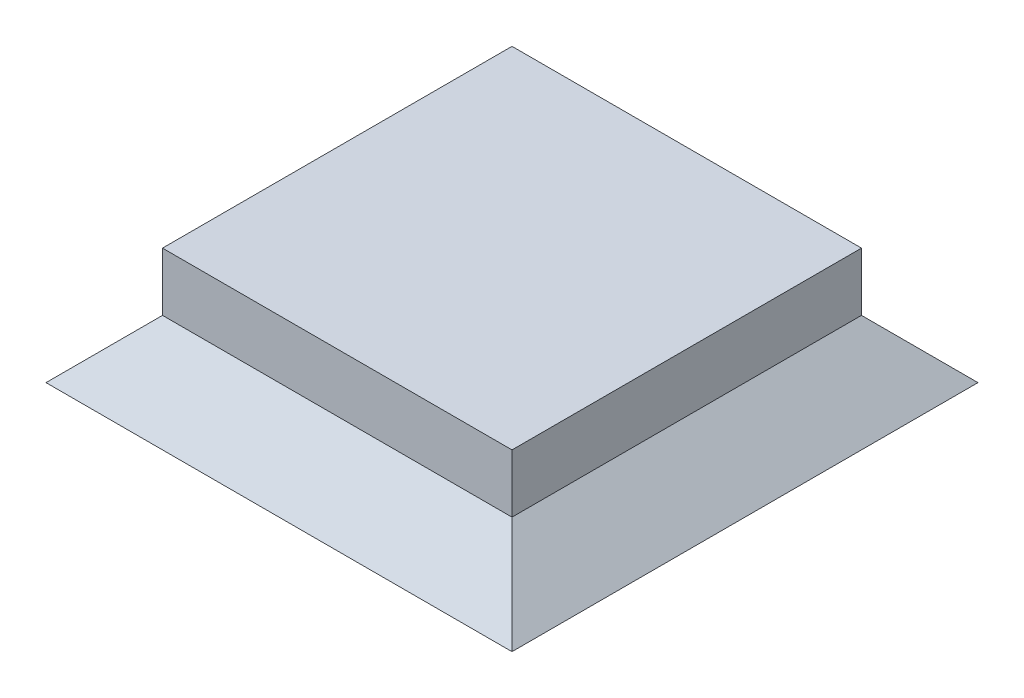
from build123d import *

# Parameters (mm, degrees)
SKETCH_1_W      = 6
SKETCH_1_H      = 6
EXTRUDE_1_DEPTH = 2
SKETCH_3_W      = 8
SKETCH_3_H      = 8
EXTRUDE_2_DEPTH = 1
CHAMFER_1_SIZE  = 1


with BuildPart() as part:
    # 草图1 → 凸台-拉伸1 (new body)
    with BuildSketch(Plane(origin=(0, 0, 0), x_dir=(1, 0, 0), z_dir=(0, 1, 0))):
        Rectangle(SKETCH_1_W, SKETCH_1_H)
    extrude(amount=EXTRUDE_1_DEPTH)

    # 草图3 → 凸台-拉伸2 (add)
    with BuildSketch(Plane(origin=(0, 0, 0), x_dir=(1, 0, 0), z_dir=(0, 1, 0))):
        Rectangle(SKETCH_3_W, SKETCH_3_H)
    extrude(amount=EXTRUDE_2_DEPTH)

    # 倒角1
    chamfer_1_edges = [part.edges().sort_by_distance(p)[0] for p in [
        (0, 1, -4),
        (4, 1, 0),
        (0, 1, 4),
        (-4, 1, 0),
    ]]
    chamfer(chamfer_1_edges, length=CHAMFER_1_SIZE - 0.0001)  # a hair under: the kernel refuses the full size


solid = part.part
